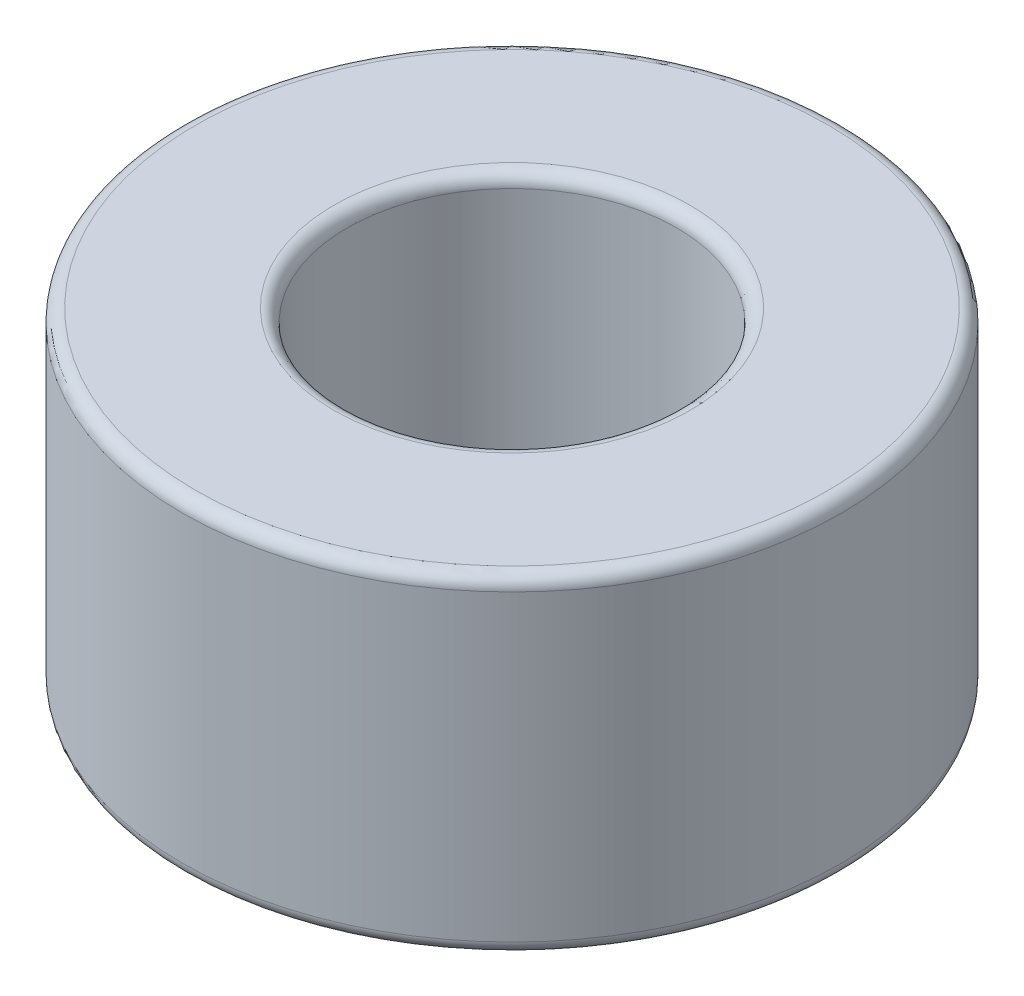
from build123d import *

# Parameters (mm, degrees)
SKETCH1_R           = 3.175
SKETCH1_R_2         = 1.5875
BOSS_EXTRUDE1_DEPTH = 1.5875
FILLET1_R           = 0.127


with BuildPart() as part:
    # Sketch1 → Boss-Extrude1 (new, symmetric)
    with BuildSketch(Plane(origin=(0, 0, 0), x_dir=(1, 0, 0), z_dir=(0, 1, 0))):
        Circle(SKETCH1_R)
        Circle(SKETCH1_R_2, mode=Mode.SUBTRACT)
    extrude(amount=BOSS_EXTRUDE1_DEPTH, both=True)

    # Fillet1
    fillet1_edges = [part.edges().sort_by_distance(p)[0] for p in [
        (-3.175, -1.5875, 0),
        (-3.175, 1.5875, 0),
        (-1.5875, -1.5875, 0),
        (-1.5875, 1.5875, 0),
    ]]
    fillet(fillet1_edges, radius=FILLET1_R)


solid = part.part
